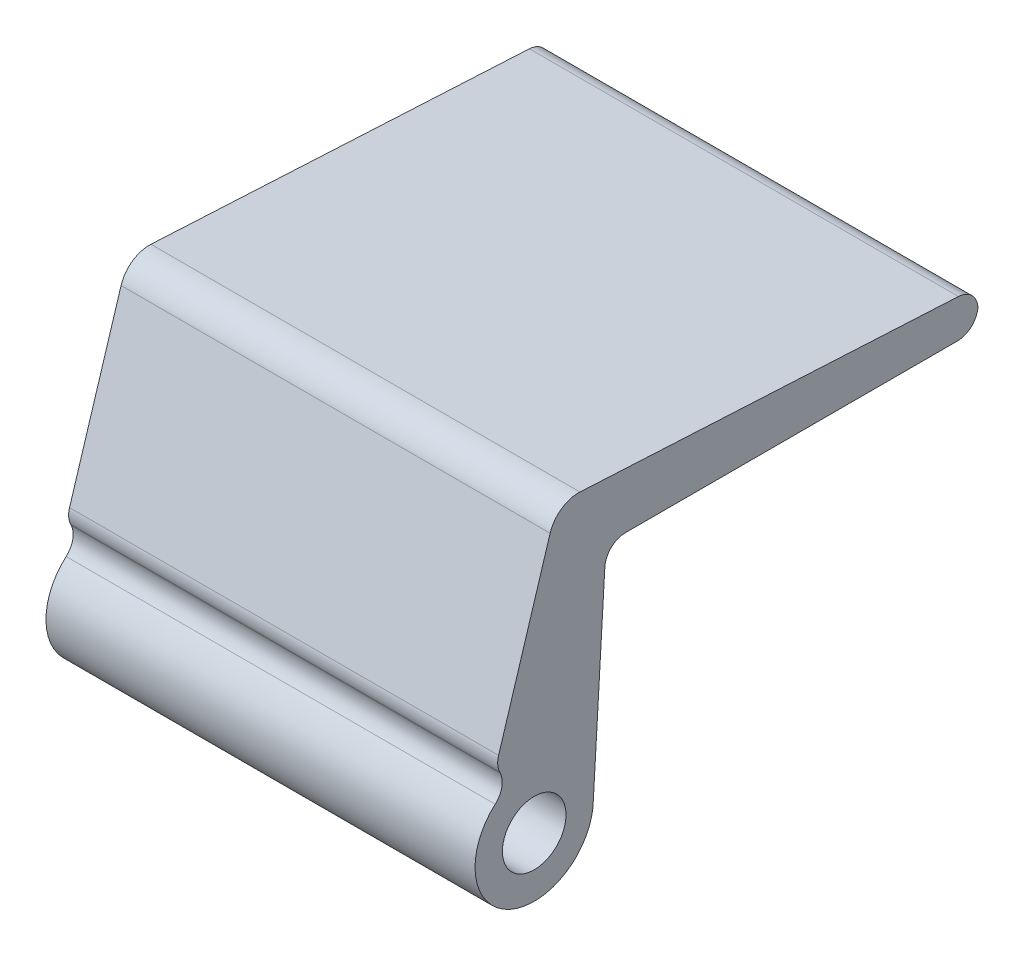
from build123d import *

# Parameters (mm, degrees)
SKETCH1_R           = 2.15
BOSS_EXTRUDE1_DEPTH = 14.5
FILLET1_R           = 2
FILLET2_R           = 1.4


with BuildPart() as part:
    # Sketch1 → Boss-Extrude1 (new, symmetric)
    with BuildSketch(Plane(origin=(0, 0, 0), x_dir=(0, 0, -1), z_dir=(1, 0, 0))):
        with BuildLine():
            Line((1.535973194, 18.500000001), (-2.572234834, 5.219922296))
            Line((-2.572234834, 5.219922296), (-1.768078738, 3.588021398))
            ThreePointArc((-1.768078738, 3.588021398), (-2.112780753, -3.396491935), (3.999999997, 1e-09))
            Line((3.999999997, 1e-09), (4.821445035, 14.000000001))
            Line((4.821445035, 14.000000001), (4.821445035, 14.500000001))
            Line((4.821445035, 14.500000001), (26.520495385, 14.500000001))
            Line((26.520495385, 14.500000001), (30.000000003, 14.500000001))
            Line((30.000000003, 14.500000001), (30.000000003, 17.000000001))
            Line((30.000000003, 17.000000001), (1.535973194, 18.500000001))
        make_face()
        with Locations(Location((0, 0, 0), (0, 0, 180))):
            Circle(SKETCH1_R, mode=Mode.SUBTRACT)
    extrude(amount=BOSS_EXTRUDE1_DEPTH, both=True)

    # Fillet1
    fillet1_edges = [part.edges().sort_by_distance(p)[0] for p in [
        (0, 18.500000001, -1.535973194),
    ]]
    fillet(fillet1_edges, radius=FILLET1_R)

    # Fillet2
    fillet2_edges = [part.edges().sort_by_distance(p)[0] for p in [
        (0, 3.588021398, 1.768078738),
        (0, 14.500000001, -4.821445035),
    ]]
    fillet(fillet2_edges, radius=FILLET2_R)
    # the kernel refuses this fillet: 1.4 mm, written as the material it takes off along each edge
    with BuildSketch(Plane(origin=(-15.893609334, 5.219922296, 2.572234834), x_dir=(0, -0.8970053501938902, -0.442019684769283), z_dir=(1, 0, 0))) as fillet2_2_piece_1:
        with BuildLine():
            CenterArc((FILLET2_R * 0.398174095356, FILLET2_R), FILLET2_R, 226.577668017, 43.422331983)
            Line((-FILLET2_R * 0.289196557818, FILLET2_R * 0.273693188002), (-FILLET2_R * 0.302943970882, FILLET2_R * 0.259167051762))
            Line((-FILLET2_R * 0.302943970882, FILLET2_R * 0.259167051762), (-FILLET2_R * 0.00796348190712, -FILLET2_R * 0.02))
            Line((-FILLET2_R * 0.00796348190712, -FILLET2_R * 0.02), (FILLET2_R * 0.398174095356, -FILLET2_R * 0.02))
            Line((FILLET2_R * 0.398174095356, -FILLET2_R * 0.02), (FILLET2_R * 0.398174095356, 0))
        make_face()
    extrude(amount=31.787218667, mode=Mode.SUBTRACT)
    with BuildSketch(Plane(origin=(17.820413203, 17.000000001, -30.000000003), x_dir=(0, 0.05262507378866547, 0.9986143407786299), z_dir=(-1, 0, 0))) as fillet2_2_piece_2:
        with BuildLine():
            CenterArc((FILLET2_R * 0.948689486547, -FILLET2_R), FILLET2_R, 90, 86.983411926)
            Line((-FILLET2_R * 0.049924854232, -FILLET2_R * 0.947374926211), (-FILLET2_R * 0.0698971410476, -FILLET2_R * 0.946322424736))
            Line((-FILLET2_R * 0.0698971410476, -FILLET2_R * 0.946322424736), (-FILLET2_R * 0.0189737897309, FILLET2_R * 0.02))
            Line((-FILLET2_R * 0.0189737897309, FILLET2_R * 0.02), (FILLET2_R * 0.948689486547, FILLET2_R * 0.02))
            Line((FILLET2_R * 0.948689486547, FILLET2_R * 0.02), (FILLET2_R * 0.948689486547, 0))
        make_face()
    extrude(amount=35.640826406, mode=Mode.SUBTRACT)
    with BuildSketch(Plane(origin=(18, 14.500000001, -30.000000003), x_dir=(0, 1, 0), z_dir=(-1, 0, 0))) as fillet2_2_piece_3:
        with BuildLine():
            CenterArc((FILLET2_R, -FILLET2_R), FILLET2_R, 90, 90)
            Line((0, -FILLET2_R), (-FILLET2_R * 0.02, -FILLET2_R))
            Line((-FILLET2_R * 0.02, -FILLET2_R), (-FILLET2_R * 0.02, FILLET2_R * 0.02))
            Line((-FILLET2_R * 0.02, FILLET2_R * 0.02), (FILLET2_R, FILLET2_R * 0.02))
            Line((FILLET2_R, FILLET2_R * 0.02), (FILLET2_R, 0))
        make_face()
    extrude(amount=36, mode=Mode.SUBTRACT)


solid = part.part
